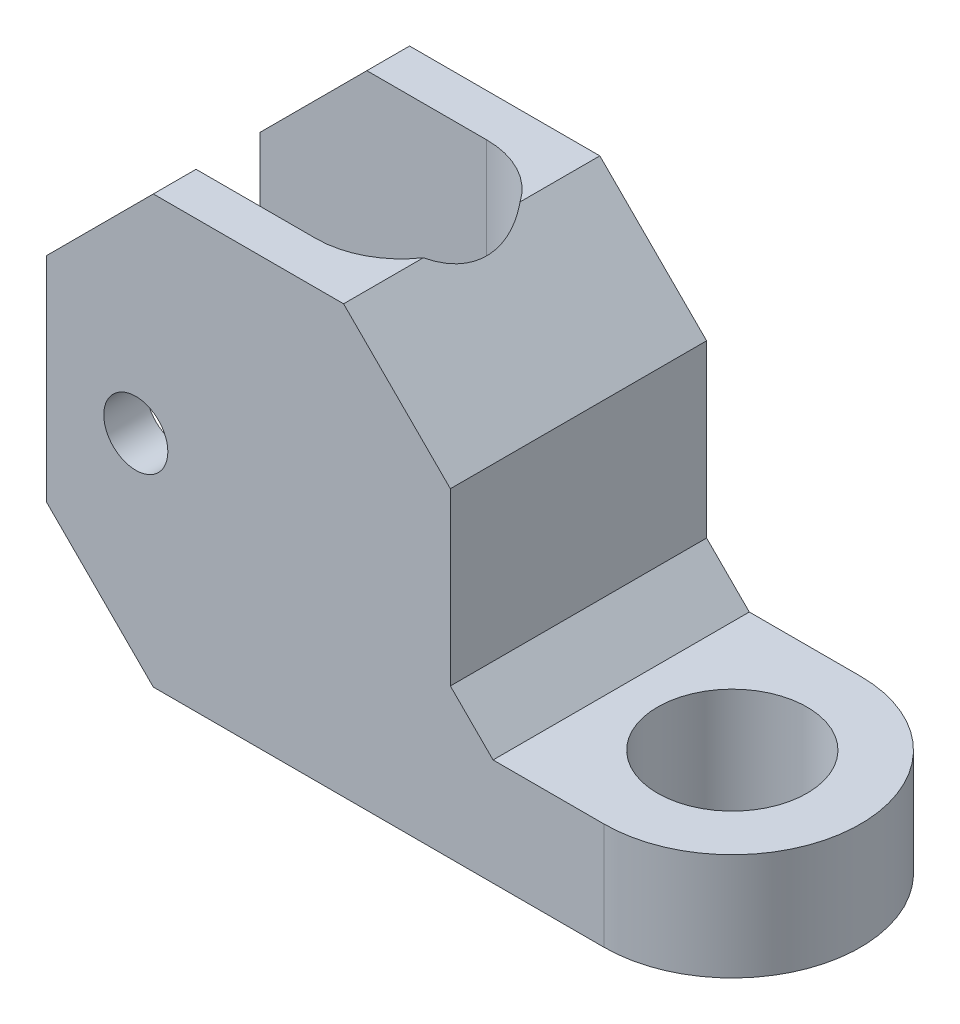
from build123d import *

# Parameters (mm, degrees)
SKETCH1_R               = 3.5
BOSS_EXTRUDE1_DEPTH     = 5
BOSS_EXTRUDE2_DEPTH     = 15
CHAMFER1_SIZE           = 5
CHAMFER2_SIZE           = 5
CUT_EXTRUDE1_DEPTH      = 32.721443851
CUT_EXTRUDE1_DEPTH_BACK = 32.721443851
SKETCH3_R               = 1.5
CHAMFER3_SIZE           = 2


with BuildPart() as part:
    # Sketch1 → Boss-Extrude1 (new body)
    with BuildSketch(Plane(origin=(0, 0, 0), x_dir=(1, 0, 0), z_dir=(0, 1, 0))):
        with BuildLine():
            Line((0, 6), (15.5, 6))
            ThreePointArc((15.5, 6), (21.5, 0), (15.5, -6))
            Line((15.5, -6), (-10.614590388, -6))
            Line((-10.614590388, -6), (-10.614590388, -4))
            Line((-10.614590388, -4), (0, -4))
            ThreePointArc((0, -4), (4, 0), (0, 4))
            Line((0, 4), (-10.614590388, 4))
            Line((-10.614590388, 4), (-10.614590388, 6))
            Line((-10.614590388, 6), (0, 6))
        make_face()
        with Locations(Location((15.5, 0, 0), (0, 0, 270))):
            Circle(SKETCH1_R, mode=Mode.SUBTRACT)
    extrude(amount=BOSS_EXTRUDE1_DEPTH)

    # Sketch2 → Boss-Extrude2 (add)
    with BuildSketch(Plane(origin=(0, 5, 0), x_dir=(1, 0, 0), z_dir=(0, 1, 0))):
        with BuildLine():
            Line((8.295961618, 6), (8.295961618, -6))
            Line((8.295961618, -6), (-10.614590388, -6))
            Line((-10.614590388, -6), (-10.614590388, -4))
            Line((-10.614590388, -4), (0, -4))
            ThreePointArc((0, -4), (4, 0), (0, 4))
            Line((0, 4), (-10.614590388, 4))
            Line((-10.614590388, 4), (-10.614590388, 6))
            Line((-10.614590388, 6), (8.295961618, 6))
        make_face()
    extrude(amount=BOSS_EXTRUDE2_DEPTH)

    # Chamfer1
    # the kernel refuses this chamfer: 5 mm, written as the material it takes off along each edge
    with BuildSketch(Plane(origin=(8.295961618, 20, -18.85841494), x_dir=(0.027495876610586317, -0.9996219169112968, 0), z_dir=(0, 0, 1))) as chamfer1_piece_1:
        Polygon((CHAMFER1_SIZE * 0.999621916911, -CHAMFER1_SIZE * 0.0274958766106), (-CHAMFER1_SIZE * 0.0274958766106, -CHAMFER1_SIZE * 0.999621916911), (0, 0), align=None)
    extrude(amount=37.71682988, mode=Mode.SUBTRACT)

    # Chamfer2
    chamfer2_edges = [part.edges().sort_by_distance(p)[0] for p in [
        (-10.614590388, 0, -5),
        (-10.614590388, 20, -5),
        (-10.614590388, 20, 5),
        (-10.614590388, 0, 5),
    ]]
    chamfer(chamfer2_edges, length=CHAMFER2_SIZE)

    # Sketch3 → Cut-Extrude1 (cut, two sides: drawn at the far end of the back side and taken through both)
    with BuildSketch(Plane.XY.offset(6).offset(-CUT_EXTRUDE1_DEPTH_BACK)):
        with Locations((-6.434668113, 9.88266285)):
            Circle(SKETCH3_R)
    extrude(amount=CUT_EXTRUDE1_DEPTH + CUT_EXTRUDE1_DEPTH_BACK, mode=Mode.SUBTRACT)

    # Chamfer3
    chamfer3_edges = [part.edges().sort_by_distance(p)[0] for p in [
        (8.295961618, 5, 0),
    ]]
    chamfer(chamfer3_edges, length=CHAMFER3_SIZE)


solid = part.part
